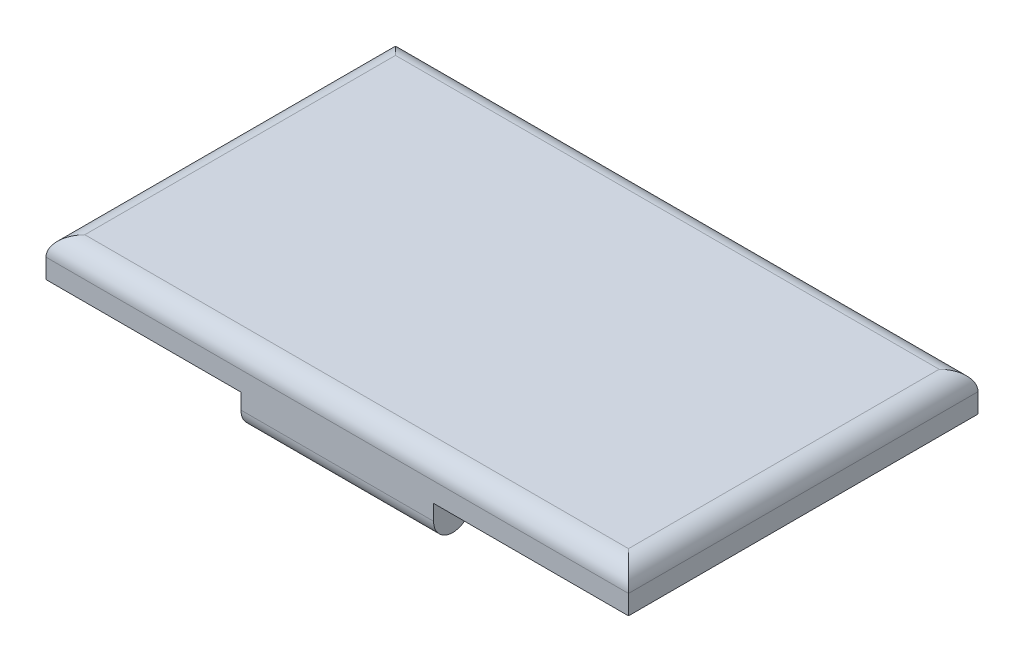
from build123d import *

# Parameters (mm, degrees)
SKETCH1_W           = 150
SKETCH1_H           = 90
BOSS_EXTRUDE1_DEPTH = 10
SKETCH2_W           = 49.6
SKETCH2_H           = 9.9
BOSS_EXTRUDE2_DEPTH = 9
SKETCH4_W           = 138
SKETCH4_H           = 58
CUT_EXTRUDE1_DEPTH  = 7
FILLET1_R           = 5


with BuildPart() as part:
    # Sketch1 → Boss-Extrude1 (new body)
    with BuildSketch(Plane(origin=(0, 0, 0), x_dir=(1, 0, 0), z_dir=(0, 1, 0))):
        with Locations((75, 45)):
            Rectangle(SKETCH1_W, SKETCH1_H)
    extrude(amount=BOSS_EXTRUDE1_DEPTH)

    # Sketch2 → Boss-Extrude2 (add)
    with BuildSketch(Plane.XZ):
        with Locations((75, -4.95)):
            Rectangle(SKETCH2_W, SKETCH2_H)
        with Locations((75, -85.05)):
            Rectangle(SKETCH2_W, SKETCH2_H)
    extrude(amount=BOSS_EXTRUDE2_DEPTH)

    # Sketch4 → Cut-Extrude1 (cut)
    with BuildSketch(Plane.XZ):
        with Locations((75, -45)):
            Rectangle(SKETCH4_W, SKETCH4_H)
    extrude(amount=-CUT_EXTRUDE1_DEPTH, mode=Mode.SUBTRACT)

    # Fillet1
    # the kernel refuses this fillet: 5 mm, written as the material it takes off along each edge
    with BuildSketch(Plane(origin=(112.3, -9, -80.1), x_dir=(0, 1, 0), z_dir=(-1, 0, 0)), Plane(origin=(37.7, -9, -90), x_dir=(0, 1, 0), z_dir=(1, 0, 0)), Plane(origin=(112.3, -9, -9.9), x_dir=(0, 0, 1), z_dir=(-1, 0, 0))) as fillet1_piece_1:
        with BuildLine():
            CenterArc((FILLET1_R, FILLET1_R), FILLET1_R, 180, 90)
            Line((0, FILLET1_R), (0, 0))
            Line((0, 0), (FILLET1_R, 0))
        make_face()
    extrude(amount=74.6, mode=Mode.SUBTRACT)
    with BuildSketch(Plane(origin=(37.7, -9, 0), x_dir=(0, 1, 0), z_dir=(1, 0, 0))) as fillet1_piece_2:
        with BuildLine():
            CenterArc((FILLET1_R, -FILLET1_R), FILLET1_R, 90, 90)
            Line((0, -FILLET1_R), (0, 0))
            Line((0, 0), (FILLET1_R, 0))
        make_face()
    extrude(amount=74.6, mode=Mode.SUBTRACT)
    with BuildSketch(Plane(origin=(150, 10, 12.5), x_dir=(-1, 0, 0), z_dir=(0, 0, -1))) as fillet1_piece_3:
        with BuildLine():
            CenterArc((FILLET1_R, -FILLET1_R), FILLET1_R, 90, 90)
            Line((0, -FILLET1_R), (0, 0))
            Line((0, 0), (FILLET1_R, 0))
        make_face()
    extrude(amount=115, mode=Mode.SUBTRACT)
    with BuildSketch(Plane(origin=(162.5, 10, -90), x_dir=(0, 0, 1), z_dir=(-1, 0, 0))) as fillet1_piece_4:
        with BuildLine():
            CenterArc((FILLET1_R, -FILLET1_R), FILLET1_R, 90, 90)
            Line((0, -FILLET1_R), (0, 0))
            Line((0, 0), (FILLET1_R, 0))
        make_face()
    extrude(amount=175, mode=Mode.SUBTRACT)
    with BuildSketch(Plane(origin=(-12.5, 10, 0), x_dir=(0, -1, 0), z_dir=(1, 0, 0))) as fillet1_piece_5:
        with BuildLine():
            CenterArc((FILLET1_R, FILLET1_R), FILLET1_R, 180, 90)
            Line((0, FILLET1_R), (0, 0))
            Line((0, 0), (FILLET1_R, 0))
        make_face()
    extrude(amount=175, mode=Mode.SUBTRACT)
    with BuildSketch(Plane(origin=(0, 10, -102.5), x_dir=(0, -1, 0), z_dir=(0, 0, 1))) as fillet1_piece_6:
        with BuildLine():
            CenterArc((FILLET1_R, FILLET1_R), FILLET1_R, 180, 90)
            Line((0, FILLET1_R), (0, 0))
            Line((0, 0), (FILLET1_R, 0))
        make_face()
    extrude(amount=115, mode=Mode.SUBTRACT)


solid = part.part
